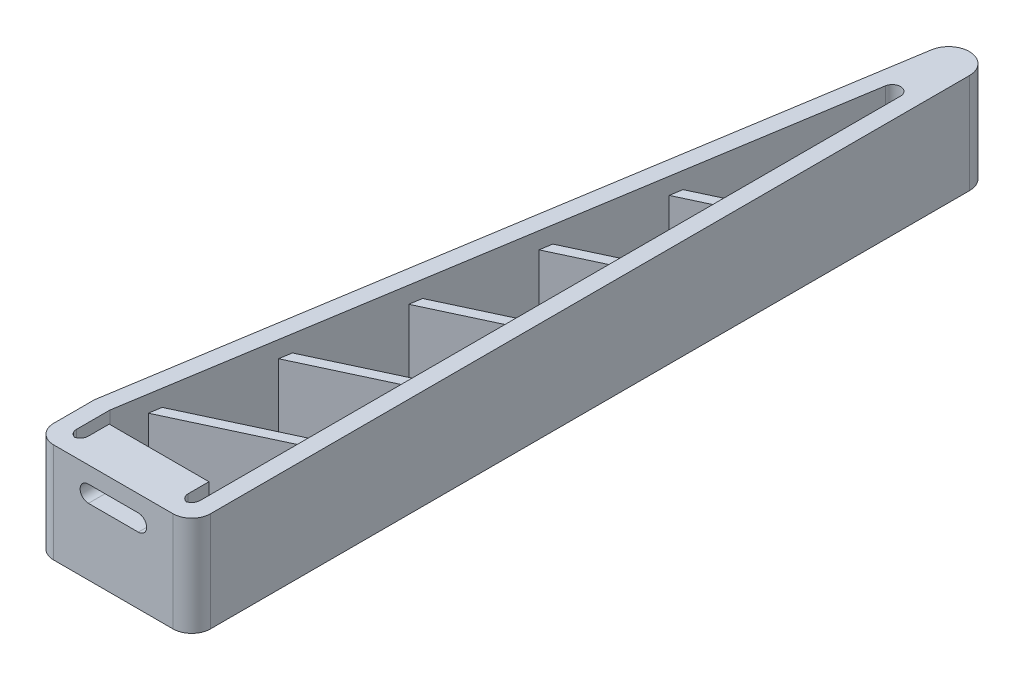
from build123d import *

# Parameters (mm, degrees)
BOSS_EXTRUDE1_DEPTH     = 6
BOSS_EXTRUDE2_DEPTH     = 4
SKETCH6_R               = 0.5
CUT_EXTRUDE1_DEPTH      = 1
FILL_START              = -19.748812638
FILL_PATTERN1_OUTLINE_R = 0.5
FILL_PATTERN1_DEPTH     = 1
FILLET1_R               = 2.25
FILLET2_R               = 1
CUT_EXTRUDE2_DEPTH      = 10


# Read off the part's stored shape, not the designer's step: Fill Pattern1
with BuildPart() as part:
    # Sketch1 → Boss-Extrude1 (new, symmetric)
    with BuildSketch(Plane(origin=(0, 0, 0), x_dir=(1, 0, 0), z_dir=(0, 1, 0))):
        with BuildLine():
            Line((0, 93.551263874), (0, 0))
            Line((0, 0), (-18.854561776, 0))
            Line((-18.854561776, 0), (-18.854561776, 7.158988901))
            Line((-18.854561776, 7.158988901), (-4.96860158, 93.946240126))
            ThreePointArc((-4.96860158, 93.946240126), (-2.301888856, 96.043401906), (0, 93.551263874))
        make_face()
        with BuildLine():
            Line((-16.854561776, 7), (-3.987440632, 87.419507149))
            ThreePointArc((-3.987440632, 87.419507149), (-2.920755543, 88.258371861), (-2, 87.261516648))
            Line((-2, 87.261516648), (-2, 2))
            Line((-2, 2), (-3.427280888, 2))
            Line((-3.427280888, 2), (-3.427280888, 5.5))
            Line((-3.427280888, 5.5), (-15.427280888, 5.5))
            Line((-15.427280888, 5.5), (-15.427280888, 2))
            Line((-15.427280888, 2), (-16.854561776, 2))
            Line((-16.854561776, 2), (-16.854561776, 7))
        make_face(mode=Mode.SUBTRACT)
    extrude(amount=BOSS_EXTRUDE1_DEPTH, both=True)

    # Sketch3 → Boss-Extrude2 (add, symmetric)
    with BuildSketch(Plane(origin=(0, 0, 0), x_dir=(1, 0, 0), z_dir=(0, 1, 0))):
        Polygon((-15.986114012, 12.427798524), (-16.21504277, 10.996993788), (-2, 17.625577093), (-2, 18.949630595), align=None)
        Polygon((-13.825513652, 25.931550771), (-14.05444241, 24.500746035), (-2, 30.121824846), (-2, 31.445878348), align=None)
        Polygon((-11.664302039, 39.439123352), (-11.893842051, 38.004498282), (-2, 42.618072599), (-2, 43.945661404), align=None)
        Polygon((-2, 56.438373855), (-9.504312933, 52.939055265), (-9.733241691, 51.508250529), (-2, 55.114320352), align=None)
        Polygon((-2, 68.934621608), (-7.343712574, 66.442807511), (-7.572641332, 65.012002776), (-2, 67.610568105), align=None)
    extrude(amount=BOSS_EXTRUDE2_DEPTH, both=True)

    # Sketch6 → Cut-Extrude1 (cut)
    with BuildSketch(Plane(origin=(-19.500780031, 0, -3.120124805), x_dir=(-0.15799050110667284, 0, 0.9874406319167055), z_dir=(-0.9874406319167055, 0, -0.15799050110667284))):
        with Locations((-47.590234861, 0)):
            Circle(SKETCH6_R)
    extrude(amount=-CUT_EXTRUDE1_DEPTH, mode=Mode.SUBTRACT)

    # Fill Pattern1 outline → Fill Pattern1 (cut)
    with BuildSketch(Plane(origin=(0, 0, 0), x_dir=(0, 1, 0), z_dir=(0.9874406319167054, 0, 0.1579905011066731)).offset(FILL_START)):
        with Locations((3, -44.590234861)):
            Circle(FILL_PATTERN1_OUTLINE_R)
        with Locations((3, -83.590234861)):
            Circle(FILL_PATTERN1_OUTLINE_R)
        with Locations((3, -8.590234861)):
            Circle(FILL_PATTERN1_OUTLINE_R)
        with Locations((0, -8.590234861)):
            Circle(FILL_PATTERN1_OUTLINE_R)
        with Locations((-3, -8.590234861)):
            Circle(FILL_PATTERN1_OUTLINE_R)
        with Locations((-3, -86.590234861)):
            Circle(FILL_PATTERN1_OUTLINE_R)
        with Locations((0, -86.590234861)):
            Circle(FILL_PATTERN1_OUTLINE_R)
        with Locations((3, -86.590234861)):
            Circle(FILL_PATTERN1_OUTLINE_R)
        with Locations((3, -5.590234861)):
            Circle(FILL_PATTERN1_OUTLINE_R)
        with Locations((-3, -80.590234861)):
            Circle(FILL_PATTERN1_OUTLINE_R)
        with Locations((0, -80.590234861)):
            Circle(FILL_PATTERN1_OUTLINE_R)
        with Locations((3, -80.590234861)):
            Circle(FILL_PATTERN1_OUTLINE_R)
        with Locations((3, -11.590234861)):
            Circle(FILL_PATTERN1_OUTLINE_R)
        with Locations((0, -11.590234861)):
            Circle(FILL_PATTERN1_OUTLINE_R)
        with Locations((-3, -11.590234861)):
            Circle(FILL_PATTERN1_OUTLINE_R)
        with Locations((-3, -83.590234861)):
            Circle(FILL_PATTERN1_OUTLINE_R)
        with Locations((0, -83.590234861)):
            Circle(FILL_PATTERN1_OUTLINE_R)
        with Locations((0, -5.590234861)):
            Circle(FILL_PATTERN1_OUTLINE_R)
        with Locations((-3, -5.590234861)):
            Circle(FILL_PATTERN1_OUTLINE_R)
        with Locations((-3, -89.590234861)):
            Circle(FILL_PATTERN1_OUTLINE_R)
        with Locations((0, -89.590234861)):
            Circle(FILL_PATTERN1_OUTLINE_R)
        with Locations((3, -89.590234861)):
            Circle(FILL_PATTERN1_OUTLINE_R)
        with Locations((0, -59.590234861)):
            Circle(FILL_PATTERN1_OUTLINE_R)
        with Locations((-3, -59.590234861)):
            Circle(FILL_PATTERN1_OUTLINE_R)
        with Locations((-3, -35.590234861)):
            Circle(FILL_PATTERN1_OUTLINE_R)
        with Locations((0, -35.590234861)):
            Circle(FILL_PATTERN1_OUTLINE_R)
        with Locations((3, -35.590234861)):
            Circle(FILL_PATTERN1_OUTLINE_R)
        with Locations((3, -56.590234861)):
            Circle(FILL_PATTERN1_OUTLINE_R)
        with Locations((0, -56.590234861)):
            Circle(FILL_PATTERN1_OUTLINE_R)
        with Locations((-3, -56.590234861)):
            Circle(FILL_PATTERN1_OUTLINE_R)
        with Locations((3, -29.590234861)):
            Circle(FILL_PATTERN1_OUTLINE_R)
        with Locations((3, -62.590234861)):
            Circle(FILL_PATTERN1_OUTLINE_R)
        with Locations((0, -62.590234861)):
            Circle(FILL_PATTERN1_OUTLINE_R)
        with Locations((-3, -62.590234861)):
            Circle(FILL_PATTERN1_OUTLINE_R)
        with Locations((-3, -32.590234861)):
            Circle(FILL_PATTERN1_OUTLINE_R)
        with Locations((0, -32.590234861)):
            Circle(FILL_PATTERN1_OUTLINE_R)
        with Locations((3, -32.590234861)):
            Circle(FILL_PATTERN1_OUTLINE_R)
        with Locations((3, -59.590234861)):
            Circle(FILL_PATTERN1_OUTLINE_R)
        with Locations((3, -41.590234861)):
            Circle(FILL_PATTERN1_OUTLINE_R)
        with Locations((3, -47.590234861)):
            Circle(FILL_PATTERN1_OUTLINE_R)
        with Locations((3, -50.590234861)):
            Circle(FILL_PATTERN1_OUTLINE_R)
        with Locations((0, -50.590234861)):
            Circle(FILL_PATTERN1_OUTLINE_R)
        with Locations((-3, -50.590234861)):
            Circle(FILL_PATTERN1_OUTLINE_R)
        with Locations((-3, -47.590234861)):
            Circle(FILL_PATTERN1_OUTLINE_R)
        with Locations((-3, -44.590234861)):
            Circle(FILL_PATTERN1_OUTLINE_R)
        with Locations((0, -44.590234861)):
            Circle(FILL_PATTERN1_OUTLINE_R)
        with Locations((-3, -38.590234861)):
            Circle(FILL_PATTERN1_OUTLINE_R)
        with Locations((0, -38.590234861)):
            Circle(FILL_PATTERN1_OUTLINE_R)
        with Locations((3, -38.590234861)):
            Circle(FILL_PATTERN1_OUTLINE_R)
        with Locations((3, -53.590234861)):
            Circle(FILL_PATTERN1_OUTLINE_R)
        with Locations((0, -53.590234861)):
            Circle(FILL_PATTERN1_OUTLINE_R)
        with Locations((-3, -53.590234861)):
            Circle(FILL_PATTERN1_OUTLINE_R)
        with Locations((-3, -41.590234861)):
            Circle(FILL_PATTERN1_OUTLINE_R)
        with Locations((0, -41.590234861)):
            Circle(FILL_PATTERN1_OUTLINE_R)
        with Locations((3, -17.590234861)):
            Circle(FILL_PATTERN1_OUTLINE_R)
        with Locations((3, -74.590234861)):
            Circle(FILL_PATTERN1_OUTLINE_R)
        with Locations((0, -74.590234861)):
            Circle(FILL_PATTERN1_OUTLINE_R)
        with Locations((-3, -74.590234861)):
            Circle(FILL_PATTERN1_OUTLINE_R)
        with Locations((-3, -20.590234861)):
            Circle(FILL_PATTERN1_OUTLINE_R)
        with Locations((0, -20.590234861)):
            Circle(FILL_PATTERN1_OUTLINE_R)
        with Locations((3, -20.590234861)):
            Circle(FILL_PATTERN1_OUTLINE_R)
        with Locations((3, -71.590234861)):
            Circle(FILL_PATTERN1_OUTLINE_R)
        with Locations((-3, -14.590234861)):
            Circle(FILL_PATTERN1_OUTLINE_R)
        with Locations((0, -14.590234861)):
            Circle(FILL_PATTERN1_OUTLINE_R)
        with Locations((3, -14.590234861)):
            Circle(FILL_PATTERN1_OUTLINE_R)
        with Locations((3, -77.590234861)):
            Circle(FILL_PATTERN1_OUTLINE_R)
        with Locations((0, -77.590234861)):
            Circle(FILL_PATTERN1_OUTLINE_R)
        with Locations((-3, -77.590234861)):
            Circle(FILL_PATTERN1_OUTLINE_R)
        with Locations((-3, -17.590234861)):
            Circle(FILL_PATTERN1_OUTLINE_R)
        with Locations((0, -17.590234861)):
            Circle(FILL_PATTERN1_OUTLINE_R)
        with Locations((-3, -26.590234861)):
            Circle(FILL_PATTERN1_OUTLINE_R)
        with Locations((0, -26.590234861)):
            Circle(FILL_PATTERN1_OUTLINE_R)
        with Locations((3, -26.590234861)):
            Circle(FILL_PATTERN1_OUTLINE_R)
        with Locations((3, -65.590234861)):
            Circle(FILL_PATTERN1_OUTLINE_R)
        with Locations((0, -65.590234861)):
            Circle(FILL_PATTERN1_OUTLINE_R)
        with Locations((-3, -65.590234861)):
            Circle(FILL_PATTERN1_OUTLINE_R)
        with Locations((-3, -29.590234861)):
            Circle(FILL_PATTERN1_OUTLINE_R)
        with Locations((0, -29.590234861)):
            Circle(FILL_PATTERN1_OUTLINE_R)
        with Locations((0, -71.590234861)):
            Circle(FILL_PATTERN1_OUTLINE_R)
        with Locations((-3, -71.590234861)):
            Circle(FILL_PATTERN1_OUTLINE_R)
        with Locations((-3, -23.590234861)):
            Circle(FILL_PATTERN1_OUTLINE_R)
        with Locations((0, -23.590234861)):
            Circle(FILL_PATTERN1_OUTLINE_R)
        with Locations((3, -23.590234861)):
            Circle(FILL_PATTERN1_OUTLINE_R)
        with Locations((3, -68.590234861)):
            Circle(FILL_PATTERN1_OUTLINE_R)
        with Locations((0, -68.590234861)):
            Circle(FILL_PATTERN1_OUTLINE_R)
        with Locations((-3, -68.590234861)):
            Circle(FILL_PATTERN1_OUTLINE_R)
    extrude(amount=FILL_PATTERN1_DEPTH, mode=Mode.SUBTRACT)

    # Fillet1
    fillet1_edges = [part.edges().sort_by_distance(p)[0] for p in [
        (-18.854561776, 0, 0),
        (-18.854561776, 0, -7.158988901),
        (0, 0, 0),
    ]]
    fillet(fillet1_edges, radius=FILLET1_R)

    # Fillet2
    # the kernel refuses this fillet: 1 mm, written as the material it adds along each edge
    with BuildSketch(Plane(origin=(-3.427280888, 6, -2), x_dir=(0, 0, -1), z_dir=(0, -1, 0)), Plane(origin=(-2, 6, -2), x_dir=(-1, 0, 0), z_dir=(0, -1, 0)), Plane(origin=(-15.427280888, 6, -2), x_dir=(-1, 0, 0), z_dir=(0, -1, 0)), Plane(origin=(-16.854561776, 6, -2), x_dir=(0, 0, -1), z_dir=(0, -1, 0))) as fillet2_piece_1:
        with BuildLine():
            CenterArc((FILLET2_R, FILLET2_R), FILLET2_R, 180, 90)
            Line((0, FILLET2_R), (0, 0))
            Line((0, 0), (FILLET2_R, 0))
        make_face()
    extrude(amount=12)

    # Sketch7 → Cut-Extrude2 (cut)
    with BuildSketch(Plane(origin=(0, 0, -5.5), x_dir=(-1, 0, 0), z_dir=(0, 0, -1))):
        with BuildLine():
            Line((12.427280888, 4), (6.427280888, 4))
            ThreePointArc((6.427280888, 4), (5.427280888, 3), (6.427280888, 2))
            Line((6.427280888, 2), (12.427280888, 2))
            ThreePointArc((12.427280888, 2), (13.427280888, 3), (12.427280888, 4))
        make_face()
    extrude(amount=-CUT_EXTRUDE2_DEPTH, mode=Mode.SUBTRACT)


solid = part.part
